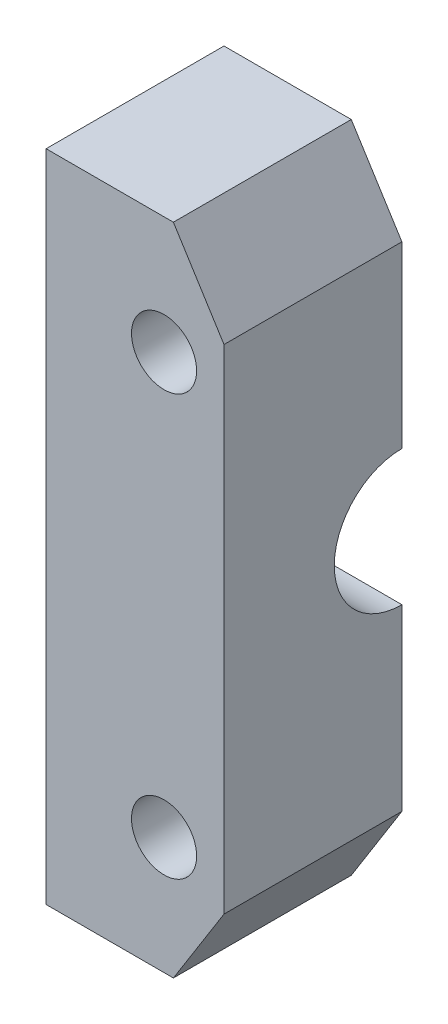
from build123d import *

# Parameters (mm, degrees)
SKETCH1_R           = 2.325
BOSS_EXTRUDE1_DEPTH = 12.7
SKETCH2_R           = 4.826
CUT_EXTRUDE1_DEPTH  = 8


with BuildPart() as part:
    # Sketch1 → Boss-Extrude1 (new body)
    with BuildSketch(Plane.XY):
        Polygon((90.626647956, 23.365008212), (81.539999992, 23.365008212), (81.539999992, -23.365008212), (90.626647956, -23.365008212), (94.239999992, -17.607359271), (94.239999992, 17.607359271), align=None)
        with Locations((89.96, -15)):
            Circle(SKETCH1_R, mode=Mode.SUBTRACT)
        with Locations((89.96, 15)):
            Circle(SKETCH1_R, mode=Mode.SUBTRACT)
    extrude(amount=BOSS_EXTRUDE1_DEPTH)

    # Sketch2 → Cut-Extrude1 (cut)
    with BuildSketch(Plane(origin=(94.239999992, 0, 0), x_dir=(0, 0, -1), z_dir=(1, 0, 0))):
        Circle(SKETCH2_R)
    extrude(amount=-CUT_EXTRUDE1_DEPTH, mode=Mode.SUBTRACT)


solid = part.part
